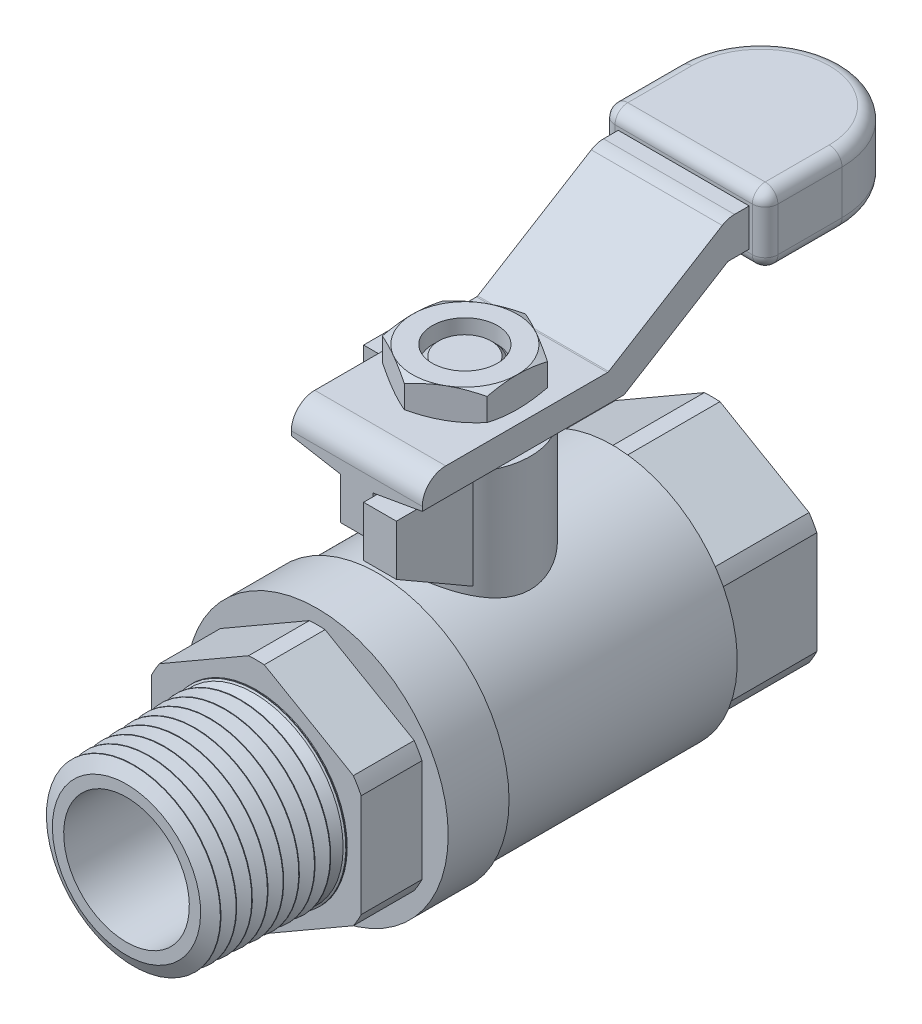
from build123d import *

# Parameters (mm, degrees)
LPATTERN2_COUNT            = 2
LPATTERN2_PITCH            = 54.356
SKETCH30_W                 = 40.3606
SKETCH30_H                 = 7.493
EXTRUDE1_DEPTH             = 54.356
CHAMFER1_SIZE              = 0.762
LPATTERN1_COUNT            = 2
LPATTERN1_PITCH            = 0.79375
LPATTERN1_COL_COUNT        = 11
LPATTERN1_COL_PITCH        = 0.79375
SKETCH26_R                 = 3.91795
EXTRUDE8_DEPTH             = 0.127
SKETCH16_W                 = 11.865428571
SKETCH16_H                 = 0.508
SKETCH16_W_2               = 7.257142857
EXTRUDE2_DEPTH             = 7.8105
SKETCH21_R                 = 3.91795
CUT_EXTRUDE1_DEPTH         = 66.004828149
FILLET1_R                  = 0.254
FILLET2_R                  = 2.794
FILLET3_R                  = 7.8105
EXTRUDE3_DEPTH             = 1.905
EXTRUDE4_DEPTH             = 1.905
EXTRUDE5_DEPTH             = 4.469217484
FILLET4_R                  = 1.524
EXTRUDE6_DEPTH             = 3.594678104
SKETCH22_W                 = 3.89255
SKETCH22_H                 = 3.594678105
CUT_EXTRUDE2_DEPTH         = 73.708746697
SKETCH24_W                 = 3.90525
SKETCH24_H                 = 6.018642215
EXTRUDE7_DEPTH             = 1.27
EXTRUDE7_DIRECTION_2_REACH = 74.709
DRAFT1_ANGLE               = 30
DRAFT2_ANGLE               = 30


with BuildPart() as part:
    # Sketch1 → Revolve1 (revolve)
    with BuildSketch(Plane(origin=(0, -2.929502347, 125.566843264), x_dir=(0, 0, -1), z_dir=(1, 0, 0))):
        Polygon((139.562243264, 2.929502347), (139.562243264, 11.770110045), (139.594938974, 11.83106174), (140.38716871, 13.307944955), (140.456302281, 13.310105487), (141.339205796, 11.885572802), (141.408339366, 11.887733334), (142.200569103, 13.364616549), (142.269702674, 13.366777081), (143.152606188, 11.942244396), (143.221739759, 11.944404928), (144.013969495, 13.421288143), (144.083103066, 13.423448675), (144.966006581, 11.99891599), (145.035140151, 12.001076522), (145.827369888, 13.477959737), (145.896503459, 13.480120269), (146.779406973, 12.055587585), (146.848540544, 12.057748117), (147.64077028, 13.534631332), (147.709903851, 13.536791864), (148.592807366, 12.112259179), (148.661940936, 12.114419711), (149.454170673, 13.591302926), (149.523304244, 13.593463458), (150.406207758, 12.168930773), (150.475341329, 12.171091305), (151.267571065, 13.64797452), (151.336704636, 13.650135052), (152.219608151, 12.225602367), (152.288741721, 12.227762899), (153.080971458, 13.704646114), (153.150105029, 13.706806647), (154.033008543, 12.282273962), (154.102142114, 12.284434494), (154.89437185, 13.761317709), (154.963505421, 13.763478241), (155.846408935, 12.338945556), (155.915542506, 12.341106088), (156.707772243, 13.817989303), (156.776905814, 13.820149835), (157.659809328, 12.39561715), (157.728942899, 12.397777682), (158.521172635, 13.874660897), (158.590306206, 13.876821429), (159.47320972, 12.452288744), (159.542343291, 12.454449276), (160.334573028, 13.931332492), (160.403706598, 13.933493024), (161.286610113, 12.508960339), (161.355743684, 12.511120871), (162.14797342, 13.988004086), (162.217106991, 13.990164618), (163.100010505, 12.565631933), (163.169144076, 12.567792465), (163.961373813, 14.04467568), (164.030507383, 14.046836212), (164.913410898, 12.622303527), (164.982544469, 12.624464059), (165.774774205, 14.101347274), (165.843907776, 14.103507806), (166.72681129, 12.678975121), (166.795944861, 12.681135654), (166.795944861, 2.929502347), align=None)
    revolve(axis=Axis((0, 0, -13.9954), (0, 0, 1)))

    # Sketch6 → Cut-Revolve3 (revolve, cut)
    with BuildSketch(Plane(origin=(0, 0, 0), x_dir=(0, 0, -1), z_dir=(1, 0, 0)), mode=Mode.PRIVATE) as cut_revolve3_sk:
        Polygon((29.4894, 0), (29.4894, 10.836874096), (41.229101597, 11.203758105), (41.229101597, 0), align=None)
    revolve(cut_revolve3_sk.sketch.rotate(Axis((0, 0, -41.229101597), (0, 0, 1)), 180), axis=Axis((0, 0, -41.229101597), (0, 0, 1)), mode=Mode.SUBTRACT)

    # Sketch7 → Revolve3 (revolve)
    with BuildSketch(Plane(origin=(0, 0, 0), x_dir=(0, 0, -1), z_dir=(1, 0, 0)), mode=Mode.PRIVATE) as revolve3_sk:
        Polygon((27.559, 9.324421283), (29.4894, 10.836874096), (29.4894, 9.384749298), align=None)
    revolve(revolve3_sk.sketch.rotate(Axis((0, 0, -13.9954), (0, 0, -1)), 270), axis=Axis((0, 0, -13.9954), (0, 0, -1)))


with BuildPart() as lpattern2_1:
    # LPattern2: pattern copy
    add(part.part.moved(Location(Vector(0, 0, 1) * (1 * LPATTERN2_PITCH))))

    # Sketch30 → Cut-Revolve8 (revolve, cut)
    with BuildSketch(Plane(origin=(0, 0, 0), x_dir=(0, 0, -1), z_dir=(1, 0, 0)), mode=Mode.PRIVATE) as cut_revolve8_sk:
        with Locations((-20.1803, 3.7465)):
            Rectangle(SKETCH30_W, SKETCH30_H)
    revolve(cut_revolve8_sk.sketch.rotate(Axis((0, 0, 40.3606), (0, 0, -1)), 270), axis=Axis((0, 0, 40.3606), (0, 0, -1)), mode=Mode.SUBTRACT)


with BuildPart() as part_1:
    add(part.part)

    # Sketch29 → Revolve6 (revolve)
    with BuildSketch(Plane(origin=(0, 0, 0), x_dir=(0, 0, -1), z_dir=(1, 0, 0)), mode=Mode.PRIVATE) as revolve6_sk:
        Polygon((-24.8666, 0), (13.9954, 0), (13.9954, 8.840607698), (12.647792302, 7.493), (-24.8666, 7.493), align=None)
    revolve(revolve6_sk.sketch.rotate(Axis((0, 0, 24.8666), (0, 0, -1)), 270), axis=Axis((0, 0, 24.8666), (0, 0, -1)))


with BuildPart() as body_3:
    # Sketch8 → Extrude1 (new body)
    with BuildSketch(Plane.XY.offset(24.8666)):
        Polygon((0, 14.430061688), (-12.4968, 7.215030844), (-12.4968, -7.215030844), (0, -14.430061688), (12.4968, -7.215030844), (12.4968, 7.215030844), align=None)
    extrude(amount=-EXTRUDE1_DEPTH)

    # Sketch9 → Revolve4 (revolve)
    with BuildSketch(Plane(origin=(0, 0, 0), x_dir=(0, 0, -1), z_dir=(1, 0, 0)), mode=Mode.PRIVATE) as revolve4_sk:
        Polygon((-17.609457143, 7.215030844), (-17.609457143, 15.621), (-10.352314286, 15.621), (-10.352314286, 15.181069695), (-10.041236584, 14.869991993), (17.623971429, 14.869991993), (17.623971429, 7.215030844), align=None)
    revolve(revolve4_sk.sketch.rotate(Axis((0, 0, 0), (0, 0, 1)), 90), axis=Axis((0, 0, 0), (0, 0, 1)))

    # Sketch10 → Revolve5 (revolve)
    with BuildSketch(Plane(origin=(0, 0, 0), x_dir=(0, 0, -1), z_dir=(1, 0, 0))):
        Polygon((0, 7.493), (0, 23.856687254), (3.91795, 23.856687254), (3.91795, 26.422087254), (7.8105, 26.422087254), (7.8105, 7.493), align=None)
        Polygon((3.89255, 26.422087254), (3.89255, 32.868782516), (0, 32.868782516), (0, 23.882087254), (3.89255, 23.882087254), align=None)
    revolve(axis=Axis((0, 0, 0), (0, 1, 0)))


with BuildPart() as revolve5_piece_1:
    # of the separate pieces the step leaves, piece 1, a body of its own (revolve5_pieces)
    add(body_3.part.solids().sort_by_distance((0, 14.430061688, 24.8666))[0])



with BuildPart() as revolve5_piece_2:
    # of the separate pieces the step leaves, piece 2, a body of its own (revolve5_pieces)
    add(body_3.part.solids().sort_by_distance((0, 32.868782516, -3.89255))[0])

    # Chamfer1
    chamfer1_edges = [revolve5_piece_2.edges().sort_by_distance(p)[0] for p in [
        (0, 32.868782516, 3.89255),
    ]]
    chamfer(chamfer1_edges, length=CHAMFER1_SIZE)

    # Sketch20 → Cut-Revolve6 (revolve, cut)
    with BuildSketch(Plane(origin=(0, 0, 0), x_dir=(0, 0, -1), z_dir=(1, 0, 0)), mode=Mode.PRIVATE) as cut_revolve6_sk:
        Polygon((3.90261393, 32.770075486), (3.973061443, 32.07912628), (3.520487642, 32.282315757), (3.500359781, 32.479729816), align=None)
    cut_revolve6 = revolve(cut_revolve6_sk.sketch.rotate(Axis((0, 32.868782516, 0.086222885), (0, -0.9948425012121004, -0.10143173951999451)), 180), axis=Axis((0, 32.868782516, 0.086222885), (0, -0.9948425012121004, -0.10143173951999451)), mode=Mode.SUBTRACT)

    # LPattern1: Cut-Revolve6 ×2
    with Locations(*[(0, i * LPATTERN1_PITCH, 0) for i in range(1, LPATTERN1_COUNT)]):
        add(cut_revolve6, mode=Mode.SUBTRACT)

    # LPattern1 col: Cut-Revolve6 ×11
    with Locations(*[(0, -i * LPATTERN1_COL_PITCH, 0) for i in range(1, LPATTERN1_COL_COUNT)]):
        add(cut_revolve6, mode=Mode.SUBTRACT)


with BuildPart() as revolve5_piece_1_1:
    add(revolve5_piece_1.part)

    add(revolve5_piece_2.part)  # Extrude8 merges Revolve5 piece 2
    # Sketch26 → Extrude8 (add)
    with BuildSketch(Plane(origin=(0, 23.856687254, 0), x_dir=(-1, 0, 0), z_dir=(0, 1, 0))):
        with Locations(Location((0, 0, 0), (0, 0, 270))):
            Circle(SKETCH26_R)
    extrude(amount=EXTRUDE8_DEPTH)

    # Sketch16 → Cut-Revolve5 (revolve, cut)
    with BuildSketch(Plane(origin=(0, 0, 0), x_dir=(0, 0, -1), z_dir=(1, 0, 0)), mode=Mode.PRIVATE) as cut_revolve5_sk:
        with Locations((23.556685715, 14.176061688)):
            Rectangle(SKETCH16_W, SKETCH16_H)
        with Locations((-21.238028572, 14.176061688)):
            Rectangle(SKETCH16_W_2, SKETCH16_H)
    revolve(cut_revolve5_sk.sketch.rotate(Axis((0, 0, 0), (0, 0, 1)), 90), axis=Axis((0, 0, 0), (0, 0, 1)), mode=Mode.SUBTRACT)

    # Combine1: cut part
    add(part_1.part, mode=Mode.SUBTRACT)


with BuildPart() as lpattern2_1_1:
    add(lpattern2_1.part)

    # Combine2: union Revolve5 piece 1
    add(revolve5_piece_1_1.part)

    # Sketch24 → Extrude7 (add)
    with BuildSketch(Plane.XY.offset(12.8905)):
        with Locations((4.03225, 22.887864735)):
            Rectangle(SKETCH24_W, SKETCH24_H)
    extrude7 = extrude(amount=EXTRUDE7_DEPTH)

    # Sketch24 → Extrude7 direction 2 (add, up to next)
    with BuildSketch(Plane.XY.offset(12.8905), mode=Mode.PRIVATE) as extrude7_direction_2_sk1:
        with Locations((4.03225, 22.887864735)):
            Rectangle(SKETCH24_W, SKETCH24_H)
    extrude7_direction_2_tool1 = extrude(extrude7_direction_2_sk1.sketch, amount=-EXTRUDE7_DIRECTION_2_REACH, mode=Mode.PRIVATE) - lpattern2_1_1.part
    extrude7_direction_2 = extrude7_direction_2_tool1.solids().sort_by_distance((4.03225, 22.887865, 12.8905))[0]
    add(extrude7_direction_2)

    # Mirror3: Extrude7, Extrude7 direction 2 across plane
    add(extrude7.mirror(Plane(origin=(0, 0, 0), x_dir=(-0.7071067811865513, 0, 0.7071067811865438), z_dir=(-0.7071067811865439, 0, -0.7071067811865512))))
    add(extrude7_direction_2.mirror(Plane(origin=(0, 0, 0), x_dir=(-0.7071067811865513, 0, 0.7071067811865438), z_dir=(-0.7071067811865439, 0, -0.7071067811865512))))

    # Draft1
    draft1_faces = [lpattern2_1_1.faces().sort_by_distance(p)[0] for p in [
        (4.136822977, 19.878543627, 10.323761745),
    ]]
    draft(draft1_faces, Plane(origin=(2.079625, 19.878543627, 14.1605), x_dir=(1, 0, 0), z_dir=(0, 0, 1)), DRAFT1_ANGLE)

    # Draft2
    draft2_faces = [lpattern2_1_1.faces().sort_by_distance(p)[0] for p in [
        (-10.323761745, 19.878543627, -4.136822977),
    ]]
    draft(draft2_faces, Plane(origin=(-14.1605, 19.878543627, -2.079625), x_dir=(0, 0, -1), z_dir=(-1, 0, 0)), DRAFT2_ANGLE)


with BuildPart() as body_2:
    # Sketch11 → Extrude2 (new, symmetric)
    with BuildSketch(Plane(origin=(0, 0, 0), x_dir=(0, 0, -1), z_dir=(1, 0, 0))):
        Polygon((43.0784, 34.773782516), (43.0784, 39.243), (23.556685714, 39.243), (9.27541033, 30.486087254), (-12.8905, 30.486087254), (-12.8905, 21.148543627), (-9.0805, 21.148543627), (-9.0805, 26.676087254), (10.3505, 26.676087254), (23.556685714, 34.773782516), align=None)
    extrude(amount=EXTRUDE2_DEPTH, both=True)

    # Sketch21 → Cut-Extrude1 (cut, through all)
    with BuildSketch(Plane(origin=(0, 30.486087254, 0), x_dir=(-1, 0, 0), z_dir=(0, 1, 0))):
        with Locations(Location((0, 0, 0), (0, 0, 90))):
            Circle(SKETCH21_R)
    extrude(amount=-CUT_EXTRUDE1_DEPTH, mode=Mode.SUBTRACT)

    # Fillet1
    fillet1_edges = [body_2.edges().sort_by_distance(p)[0] for p in [
        (0, 30.486087254, -9.27541033),
        (0, 34.773782516, -23.556685714),
        (0, 26.676087254, 9.0805),
    ]]
    fillet(fillet1_edges, radius=FILLET1_R)

    # Fillet2
    fillet2_edges = [body_2.edges().sort_by_distance(p)[0] for p in [
        (0, 39.243, -23.556685714),
        (0, 26.676087254, -10.3505),
        (0, 30.486087254, 12.8905),
    ]]
    fillet(fillet2_edges, radius=FILLET2_R)

    # Fillet3
    fillet3_edges = [body_2.edges().sort_by_distance(p)[0] for p in [
        (-7.8105, 37.008391258, -43.0784),
        (7.8105, 37.008391258, -43.0784),
    ]]
    fillet(fillet3_edges, radius=FILLET3_R - 0.0001)  # a hair under: the kernel refuses the full size

    # Sketch23 → Cut-Extrude2 (cut, through all)
    with BuildSketch(Plane.XY.offset(12.8905)):
        Polygon((-7.8105, 27.184087254), (-1.952625, 26.151185842), (-1.952625, 21.148543627), (1.952625, 21.148543627), (1.952625, 26.151185842), (7.8105, 27.184087254), (7.8105, 19.878543627), (-7.8105, 19.878543627), align=None)
    extrude(amount=-CUT_EXTRUDE2_DEPTH, mode=Mode.SUBTRACT)


with BuildPart() as body_3_2:
    # Sketch12 → Extrude3 (new body)
    with BuildSketch(Plane(origin=(0, 39.243, 0), x_dir=(-1, 0, 0), z_dir=(0, 1, 0))):
        with BuildLine():
            Line((9.7155, -26.096685714), (-9.7155, -26.096685714))
            Line((-9.7155, -26.096685714), (-9.7155, -35.2679))
            ThreePointArc((-9.7155, -35.2679), (0, -44.9834), (9.7155, -35.2679))
            Line((9.7155, -35.2679), (9.7155, -26.096685714))
        make_face()
    extrude(amount=EXTRUDE3_DEPTH)



with BuildPart() as body_4:
    # Sketch13 → Extrude4 (new body)
    with BuildSketch(Plane.XZ.offset(-34.773782516)):
        with BuildLine():
            Line((9.7155, -26.096685714), (-9.7155, -26.096685714))
            Line((-9.7155, -26.096685714), (-9.7155, -35.2679))
            ThreePointArc((-9.7155, -35.2679), (0, -44.9834), (9.7155, -35.2679))
            Line((9.7155, -35.2679), (9.7155, -26.096685714))
        make_face()
    extrude(amount=EXTRUDE4_DEPTH)


with BuildPart() as body_3_2_1:
    add(body_3_2.part)

    add(body_4.part)  # Extrude5 merges body 4
    # Sketch14 → Extrude5 (add)
    with BuildSketch(Plane.XZ.offset(-39.243)):
        with BuildLine():
            Line((-7.8105, -35.2679), (-7.8105, -26.096685714))
            Line((-7.8105, -26.096685714), (-9.7155, -26.096685714))
            Line((-9.7155, -26.096685714), (-9.7155, -35.2679))
            ThreePointArc((-9.7155, -35.2679), (0, -44.9834), (9.7155, -35.2679))
            Line((9.7155, -35.2679), (9.7155, -26.096685714))
            Line((9.7155, -26.096685714), (7.8105, -26.096685714))
            Line((7.8105, -26.096685714), (7.8105, -35.2679))
            ThreePointArc((7.8105, -35.2679), (5.522857514, -40.790757514), (0, -43.0784))
            ThreePointArc((0, -43.0784), (-5.522857514, -40.790757514), (-7.8105, -35.2679))
        make_face()
    extrude(amount=EXTRUDE5_DEPTH)

    # Fillet4
    fillet4_edges = [body_3_2_1.edges().sort_by_distance(p)[0] for p in [
        (-9.7155, 41.148, -30.682292857),
        (0, 41.148, -26.096685714),
        (-9.7155, 32.868782516, -30.682292857),
        (0, 32.868782516, -44.9834),
        (9.7155, 32.868782516, -30.682292857),
        (0, 32.868782516, -26.096685714),
        (9.7155, 41.148, -30.682292857),
        (0, 41.148, -44.9834),
        (9.7155, 37.008391258, -26.096685714),
        (-9.7155, 37.008391258, -26.096685714),
    ]]
    fillet(fillet4_edges, radius=FILLET4_R)


with BuildPart() as body_4_2:
    # Sketch15 → Extrude6 (new body)
    with BuildSketch(Plane(origin=(0, 30.486087254, 0), x_dir=(-1, 0, 0), z_dir=(0, 1, 0))):
        Polygon((0, 7.215030844), (-6.2484, 3.607515422), (-6.2484, -3.607515422), (0, -7.215030844), (6.2484, -3.607515422), (6.2484, 3.607515422), align=None)
    extrude(amount=EXTRUDE6_DEPTH)

    # Sketch22 → Cut-Revolve7 (revolve, cut)
    with BuildSketch(Plane(origin=(0, 0, 0), x_dir=(0, 0, -1), z_dir=(1, 0, 0)), mode=Mode.PRIVATE) as cut_revolve7_sk:
        Polygon((6.2484, 34.080765359), (7.215030844, 34.080765359), (7.215030844, 33.630017994), align=None)
        with Locations((1.946275, 32.283426307)):
            Rectangle(SKETCH22_W, SKETCH22_H)
        Polygon((6.2484, 30.486087254), (7.215030844, 30.486087254), (7.215030844, 30.936834619), align=None)
    revolve(cut_revolve7_sk.sketch.rotate(Axis((0, 0, 0), (0, 1, 0)), 54.674824838), axis=Axis((0, 0, 0), (0, 1, 0)), mode=Mode.SUBTRACT)


solid = Compound([lpattern2_1_1.part, body_2.part, body_3_2_1.part, body_4_2.part])
